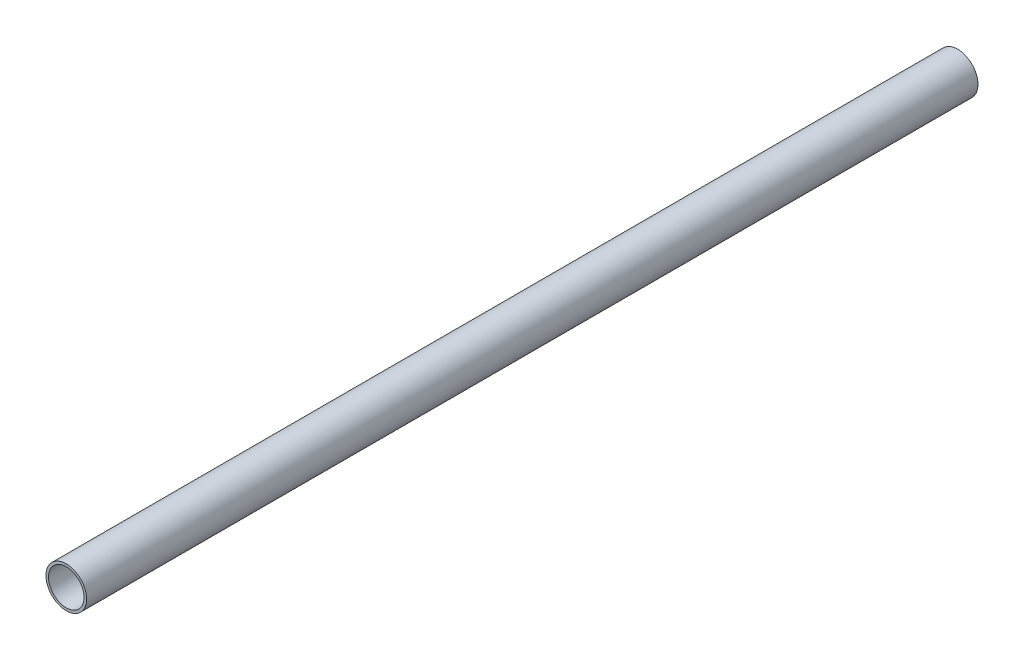
from build123d import *

# Parameters (mm, degrees)
SKETCH2_R           = 12.7
SKETCH2_R_2         = 11.1125
BOSS_EXTRUDE1_DEPTH = 278.4249956


with BuildPart() as part:
    # Sketch2 → Boss-Extrude1 (new, symmetric)
    with BuildSketch(Plane.XY):
        Circle(SKETCH2_R)
        Circle(SKETCH2_R_2, mode=Mode.SUBTRACT)
    extrude(amount=BOSS_EXTRUDE1_DEPTH, both=True)


solid = part.part
